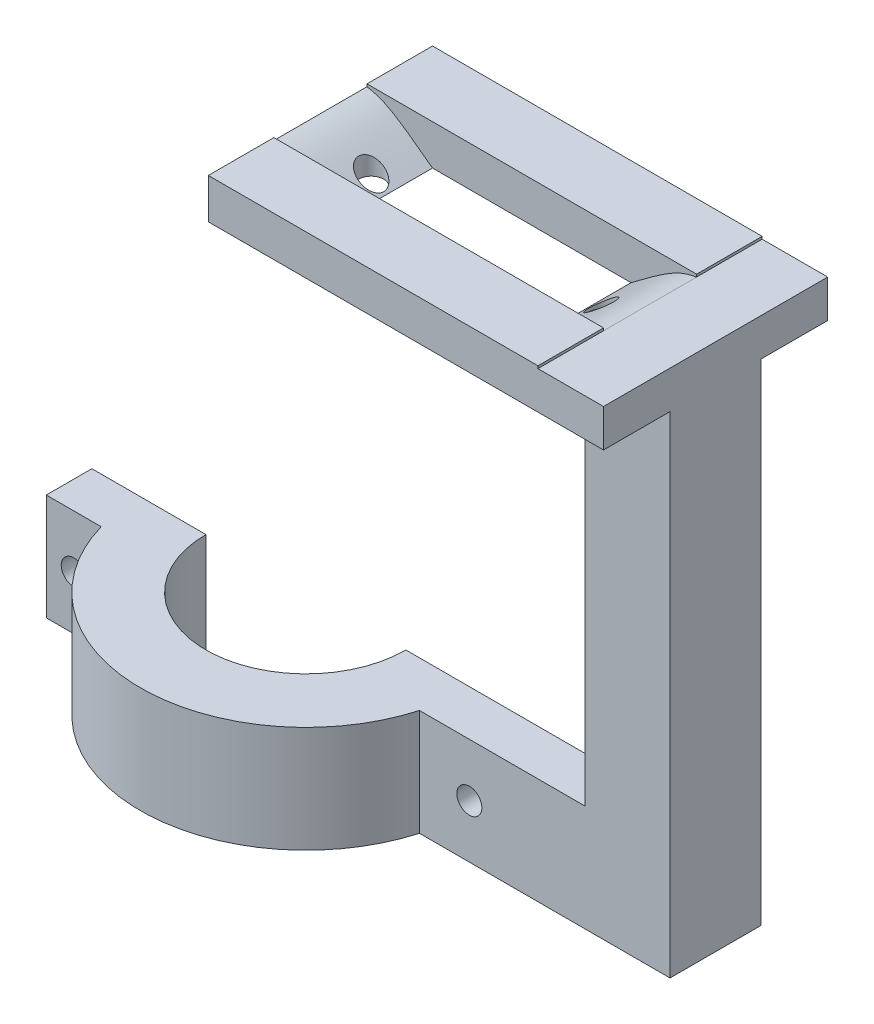
from build123d import *

# Parameters (mm, degrees)
SKETCH_1_W           = 50.28
SKETCH_1_H           = 34.2
SKETCH_1_W_2         = 30.28
SKETCH_1_H_2         = 14.2
EXTRUDE_1_DEPTH      = 12.25
SKETCH_4_W           = 13
SKETCH_4_H           = 13.91
EXTRUDE_1_2_DEPTH    = 74.82
SKETCH_5_W           = 13.91
SKETCH_5_H           = 16.23
EXTRUDE_2_DEPTH      = 16
SKETCH_7_R           = 25.25
SKETCH_7_R_2         = 15.25
EXTRUDE_2_2_DEPTH    = 16.23
SKETCH_15_R          = 1.91
CUT_EXTRUDE_6_DEPTH  = 97.964478439
SKETCH_16_W          = 13.91
SKETCH_16_H          = 16.23
EXTRUDE_4_DEPTH      = 10
SKETCH_17_R          = 1.91
CUT_EXTRUDE_7_DEPTH  = 102.16913771
SKETCH_18_W          = 49.344544624
SKETCH_18_H          = 6.125
CUT_EXTRUDE_8_DEPTH  = 105.840616652
SKETCH_19_W          = 34.2
SKETCH_19_H          = 6.125
CUT_EXTRUDE_9_DEPTH  = 10
SKETCH_21_R          = 1.91
CUT_EXTRUDE_10_DEPTH = 10
SKETCH_20_R          = 1.91
CUT_EXTRUDE_11_DEPTH = 10
FILLET_START         = -7.1
FILLET_1_DEPTH       = 14.2
FILLET_2_DEPTH       = 14.2
SKETCH_29_W          = 13.91
SKETCH_29_H          = 74.82
EXTRUDE_5_DEPTH      = 10
SKETCH_30_W          = 10
SKETCH_30_H          = 58.59
CUT_EXTRUDE_13_DEPTH = 102.16913771
SKETCH_32_W          = 34.2
SKETCH_32_H          = 5.745736365
EXTRUDE_6_DEPTH      = 10
SKETCH_33_W          = 107.115454733
SKETCH_33_H          = 42.36882751
CUT_EXTRUDE_14_DEPTH = 92.791032993


with BuildPart() as part:
    # 草圖1 → Extrude 1 (new body)
    with BuildSketch(Plane(origin=(0, 0, 0), x_dir=(1, 0, 0), z_dir=(0, 1, 0))):
        Rectangle(SKETCH_1_W, SKETCH_1_H)
        Rectangle(SKETCH_1_W_2, SKETCH_1_H_2, mode=Mode.SUBTRACT)
    extrude(amount=EXTRUDE_1_DEPTH)

    # 草圖4 → Extrude 1 2 (add)
    with BuildSketch(Plane.XZ):
        with Locations((18.64, 0)):
            Rectangle(SKETCH_4_W, SKETCH_4_H)
    extrude(amount=EXTRUDE_1_2_DEPTH)

    # 草圖5 → Extrude 2 (add)
    with BuildSketch(Plane.ZY.offset(-12.14)):
        with Locations((0, -66.705)):
            Rectangle(SKETCH_5_W, SKETCH_5_H)
    extrude(amount=EXTRUDE_2_DEPTH)

    # 草圖7 → Extrude 2 2 (add)
    with BuildSketch(Plane(origin=(3.626674765, -74.82, 0), x_dir=(1, 0, 0), z_dir=(0, -1, 0))):
        with Locations((-30.978154344, 0)):
            Circle(SKETCH_7_R)
        with Locations((-30.978154344, 0)):
            Circle(SKETCH_7_R_2, mode=Mode.SUBTRACT)
    extrude(amount=-EXTRUDE_2_2_DEPTH)

    # 草圖15 → 除料-伸長6 (cut, through all)
    with BuildSketch(Plane(origin=(0, 0, -6.955), x_dir=(-1, 0, 0), z_dir=(0, 0, -1))):
        with Locations((-4.530883248, -66.705)):
            Circle(SKETCH_15_R)
    extrude(amount=-CUT_EXTRUDE_6_DEPTH, mode=Mode.SUBTRACT)

    # 草圖16 → 填料-伸長4 (add)
    with BuildSketch(Plane(origin=(-60, 0, 0), x_dir=(0, 0, -1), z_dir=(1, 0, 0))):
        with Locations((0, -66.705)):
            Rectangle(SKETCH_16_W, SKETCH_16_H)
    extrude(amount=EXTRUDE_4_DEPTH)

    # 草圖17 → 除料-伸長7 (cut, through all)
    with BuildSketch(Plane(origin=(0, 0, -6.955), x_dir=(-1, 0, 0), z_dir=(0, 0, -1))):
        with Locations((55.812362827, -66.705)):
            Circle(SKETCH_17_R)
    extrude(amount=-CUT_EXTRUDE_7_DEPTH, mode=Mode.SUBTRACT)

    # 草圖18 → 除料-伸長8 (cut, through all)
    with BuildSketch(Plane(origin=(0, 0, -17.1), x_dir=(-1, 0, 0), z_dir=(0, 0, -1))):
        with Locations((0.467727688, 9.1875)):
            Rectangle(SKETCH_18_W, SKETCH_18_H)
    extrude(amount=-CUT_EXTRUDE_8_DEPTH, mode=Mode.SUBTRACT)

    # 草圖19 → 除料-伸長9 (cut)
    with BuildSketch(Plane.ZY.offset(-24.204544624)):
        with Locations((0, 9.1875)):
            Rectangle(SKETCH_19_W, SKETCH_19_H)
    extrude(amount=-CUT_EXTRUDE_9_DEPTH, mode=Mode.SUBTRACT)

    # 草圖21 → 除料-伸長10 (cut)
    with BuildSketch(Plane(origin=(0, 6.125, 0), x_dir=(1, 0, 0), z_dir=(0, 1, 0))):
        with Locations(Location((17.69, 0, 0), (0, 0, 270))):
            Circle(SKETCH_21_R)
    extrude(amount=-CUT_EXTRUDE_10_DEPTH, mode=Mode.SUBTRACT)

    # 草圖20 → 除料-伸長11 (cut)
    with BuildSketch(Plane(origin=(0, 6.125, 0), x_dir=(1, 0, 0), z_dir=(0, 1, 0))):
        with Locations(Location((-17.395, 0, 0), (0, 0, 270))):
            Circle(SKETCH_20_R)
    extrude(amount=-CUT_EXTRUDE_11_DEPTH, mode=Mode.SUBTRACT)

    # 圓角1: read off the stored shape, not the designer's step
    # 圓角1 outline → 圓角1 (cut)
    with BuildSketch(Plane.XY.offset(FILLET_START)):
        with BuildLine():
            add(Edge.make_bspline(
                [(-15.14, 0), (-21.974170252, 5.199829476), (-25.14, 5.745736365)],
                knots=[0, 0, 0, 0.664102345, 0.664102345, 0.664102345], degree=2, weights=[1, 2.223777218, 1.822127795]))
            Line((-15.14, 0), (-15.14, 6.125))
            Line((-15.14, 6.125), (-25.14, 6.125))
            Line((-25.14, 6.125), (-25.14, 5.745736365))
        make_face()
    extrude(amount=FILLET_1_DEPTH, mode=Mode.SUBTRACT)

    # 圓角2: read off the stored shape, not the designer's step
    # 圓角2 outline → 圓角2 (cut)
    with BuildSketch(Plane.XY.offset(FILLET_START)):
        with BuildLine():
            Line((15.14, 6.125), (15.14, 0))
            add(Edge.make_bspline(
                [(15.14, 0), (21.974170252, 5.199829476), (25.14, 5.745736365)],
                knots=[0, 0, 0, 0.664102345, 0.664102345, 0.664102345], degree=2, weights=[1, 2.223777218, 1.822127795]))
            Line((25.14, 5.745736365), (25.14, 6.125))
            Line((25.14, 6.125), (15.14, 6.125))
        make_face()
    extrude(amount=FILLET_2_DEPTH, mode=Mode.SUBTRACT)

    # 草圖29 → 填料-伸長5 (add)
    with BuildSketch(Plane(origin=(25.14, 0, 0), x_dir=(0, 0, -1), z_dir=(1, 0, 0))):
        with Locations((0, -37.41)):
            Rectangle(SKETCH_29_W, SKETCH_29_H)
    extrude(amount=EXTRUDE_5_DEPTH)

    # 草圖30 → 除料-伸長13 (cut, through all)
    with BuildSketch(Plane.XY.offset(6.955)):
        with Locations((17.14, -29.295)):
            Rectangle(SKETCH_30_W, SKETCH_30_H)
    extrude(amount=-CUT_EXTRUDE_13_DEPTH, mode=Mode.SUBTRACT)

    # 草圖32 → 填料-伸長6 (add)
    with BuildSketch(Plane(origin=(25.14, 0, 0), x_dir=(0, 0, -1), z_dir=(1, 0, 0))):
        with Locations((0, 2.872868182)):
            Rectangle(SKETCH_32_W, SKETCH_32_H)
    extrude(amount=EXTRUDE_6_DEPTH)

    # 草圖33 → 除料-伸長14 (cut, through all)
    with BuildSketch(Plane(origin=(0, -58.59, 0), x_dir=(1, 0, 0), z_dir=(0, 1, 0))):
        with Locations((-31.417727367, 21.184413755)):
            Rectangle(SKETCH_33_W, SKETCH_33_H)
    extrude(amount=-CUT_EXTRUDE_14_DEPTH, mode=Mode.SUBTRACT)


solid = part.part
